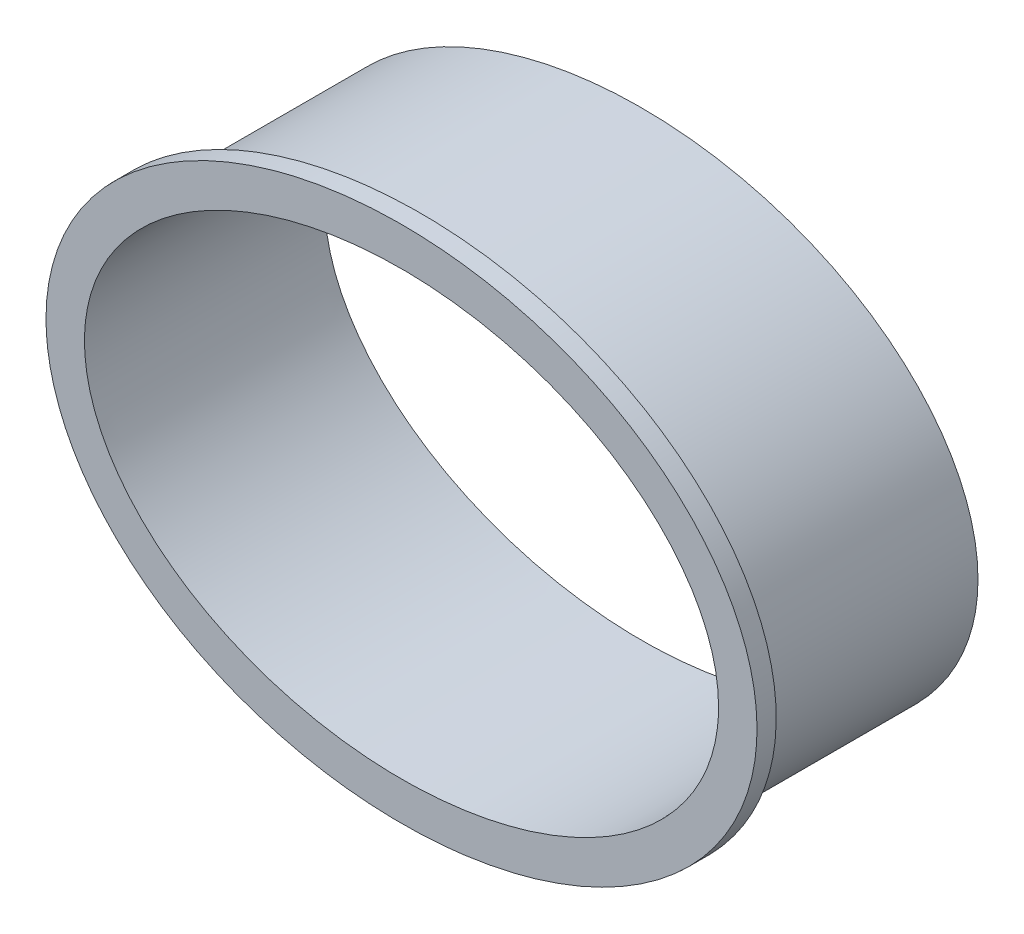
from build123d import *

# Parameters (mm, degrees)
EXTRUDE_1_DEPTH = 25
EXTRUDE_2_DEPTH = 2


# Read off the part's stored shape, not the designer's step: 填料-伸長1
with BuildPart() as part:
    # 填料-伸長1 outline → 填料-伸長1 (new body)
    with BuildSketch(Plane.XY):
        with BuildLine():
            add(Edge.make_bspline(
                [(35, 0), (35, 43.301270189), (-17.5, 21.650635095), (-70, 0), (-17.5, -21.650635095), (35, -43.301270189), (35, 0)],
                knots=[0, 0, 0, 2.094395102, 2.094395102, 4.188790205, 4.188790205, 6.283185307, 6.283185307, 6.283185307], degree=2, weights=[1, 0.5, 1, 0.5, 1, 0.5, 1]))
        make_face()
        with BuildLine():
            add(Edge.make_bspline(
                [(33, 0), (33, 2.91062285), (31.39993461, 8.73186855), (24.234101357, 16.455208235), (13.181225686, 21.748514032), (0, 23.625742984), (-13.181225686, 21.748514032), (-24.234101357, 16.455208235), (-31.39993461, 8.73186855), (-33.800032695, 0), (-31.39993461, -8.73186855), (-24.234101357, -16.455208235), (-13.181225686, -21.748514032), (0, -23.625742984), (13.181225686, -21.748514032), (24.234101357, -16.455208235), (31.39993461, -8.73186855), (33, -2.91062285), (33, 0)],
                knots=[0, 0, 0, 0, 0.392699082, 0.785398163, 1.178097245, 1.570796327, 1.963495408, 2.35619449, 2.748893572, 3.141592654, 3.534291735, 3.926990817, 4.319689899, 4.71238898, 5.105088062, 5.497787144, 5.890486225, 6.283185307, 6.283185307, 6.283185307, 6.283185307], degree=3))
        make_face(mode=Mode.SUBTRACT)
    extrude(amount=EXTRUDE_1_DEPTH)

    # 草圖2 → 填料-伸長2 (add)
    with BuildSketch(Plane.XY.offset(25)):
        with BuildLine():
            add(Edge.make_bspline(
                [(-37, 0), (-37, -2.136832017), (-36.660364323, -4.204280496), (-35.854316476, -6.710654505), (-35.67375068, -7.20797506), (-35.273935101, -8.194713489), (-35.055732014, -8.681236431), (-34.355276409, -10.107573172), (-33.825011398, -11.020183003), (-32.943433003, -12.33697453), (-32.635160203, -12.767187684), (-31.990735827, -13.610752576), (-31.653741168, -14.024967171), (-30.614345273, -15.229230134), (-29.880747277, -15.985362497), (-27.572530789, -18.130376645), (-25.889784944, -19.398189238), (-22.285928318, -21.64737414), (-20.413023851, -22.599258986), (-16.550004255, -24.217817778), (-14.559587544, -24.883757879), (-11.492367383, -25.684121157), (-10.45654693, -25.917207139), (-8.385534071, -26.312972134), (-7.346888776, -26.476613945), (-4.22189821, -26.868765359), (-2.126562083, -26.99919714), (1.034267364, -27.000395928), (2.093980935, -26.967984163), (4.2038584, -26.837232933), (5.251492414, -26.739276321), (8.3726586, -26.348458742), (10.424627929, -25.959421732), (14.467927585, -24.910881534), (16.459360378, -24.251835375), (18.904729516, -23.232124452), (19.391138731, -23.018416315), (20.351032648, -22.574194411), (20.825525229, -22.343270937), (22.232243483, -21.623422567), (23.147759775, -21.107500677), (24.931011666, -19.998458643), (25.79876899, -19.405373602), (27.060807507, -18.45176925), (27.474871072, -18.123211898), (28.288890792, -17.443304151), (28.689451842, -17.091301544), (30.633515315, -15.290092597), (32.019319225, -13.707088755), (33.791271404, -11.075450611), (34.332239988, -10.14914823), (35.268555763, -8.252953875), (35.667947997, -7.278437245), (36.157109697, -5.774428981), (36.301794863, -5.266035709), (36.552615777, -4.234438653), (36.658979766, -3.709069851), (36.913064395, -2.136299253), (36.998082413, -1.086565042), (37.001853661, 1.015308483), (36.920614652, 2.067447685), (36.670553165, 3.647511008), (36.566236551, 4.170758002), (36.319274546, 5.200902154), (36.176388964, 5.709360633), (35.6917894, 7.215669264), (35.294317863, 8.194515756), (34.591727483, 9.626527307), (34.339417598, 10.098090014), (33.807398354, 11.01685501), (33.526919467, 11.465741), (32.644588542, 12.782732843), (32.001984412, 13.621275711), (30.617203699, 15.226128118), (29.872190359, 15.994198283), (27.548576668, 18.150845672), (25.868885919, 19.411747392), (23.187751552, 21.084282892), (22.26475507, 21.605896701), (20.37556149, 22.574392282), (19.41769894, 23.017259963), (16.508056935, 24.233398048), (14.520516048, 24.895117206), (11.475189145, 25.688011085), (10.449327679, 25.918768594), (8.376519332, 26.31451152), (7.326434353, 26.479756877), (4.181332095, 26.872681011), (2.08407981, 27.000560373), (-2.111416204, 26.999435964), (-4.209659909, 26.87043863), (-6.833113477, 26.541052501), (-7.358756476, 26.466548615), (-8.403870267, 26.301202701), (-8.923628306, 26.210359037), (-10.474511105, 25.913331257), (-11.497260878, 25.68269803), (-14.531457815, 24.891389182), (-16.509189357, 24.232287493), (-19.400773884, 23.024650023), (-20.352058471, 22.585388374), (-21.758277531, 21.866043529), (-22.223558249, 21.61616414), (-23.146782643, 21.094986327), (-23.605552531, 20.823120252), (-25.8578096, 19.420710113), (-27.542882479, 18.155153757), (-29.476967072, 16.361263564), (-29.855067914, 15.991761248), (-30.592685053, 15.229890153), (-30.953167838, 14.83638597), (-31.997318386, 13.627441536), (-32.640688315, 12.787854352), (-33.81474145, 11.036823876), (-34.345492048, 10.125423557), (-35.047761852, 8.698474559), (-35.266805586, 8.211200014), (-35.668235181, 7.2226618), (-35.849534466, 6.724414423), (-36.335140549, 5.217728209), (-36.581364818, 4.197388167), (-36.830662237, 2.642281917), (-36.893704509, 2.119803482), (-36.978371825, 1.066360153), (-37, 0.534208004), (-37, 0)],
                knots=[0, 0, 0, 0, 0.03125, 0.03125, 0.0390625, 0.0390625, 0.046875, 0.046875, 0.0625, 0.0625, 0.0703125, 0.0703125, 0.078125, 0.078125, 0.09375, 0.09375, 0.125, 0.125, 0.15625, 0.15625, 0.1875, 0.1875, 0.203125, 0.203125, 0.21875, 0.21875, 0.25, 0.25, 0.265625, 0.265625, 0.28125, 0.28125, 0.3125, 0.3125, 0.34375, 0.34375, 0.3515625, 0.3515625, 0.359375, 0.359375, 0.375, 0.375, 0.390625, 0.390625, 0.3984375, 0.3984375, 0.40625, 0.40625, 0.4375, 0.4375, 0.453125, 0.453125, 0.46875, 0.46875, 0.4765625, 0.4765625, 0.484375, 0.484375, 0.5, 0.5, 0.515625, 0.515625, 0.5234375, 0.5234375, 0.53125, 0.53125, 0.546875, 0.546875, 0.5546875, 0.5546875, 0.5625, 0.5625, 0.578125, 0.578125, 0.59375, 0.59375, 0.625, 0.625, 0.640625, 0.640625, 0.65625, 0.65625, 0.6875, 0.6875, 0.703125, 0.703125, 0.71875, 0.71875, 0.75, 0.75, 0.78125, 0.78125, 0.7890625, 0.7890625, 0.796875, 0.796875, 0.8125, 0.8125, 0.84375, 0.84375, 0.859375, 0.859375, 0.8671875, 0.8671875, 0.875, 0.875, 0.90625, 0.90625, 0.9140625, 0.9140625, 0.921875, 0.921875, 0.9375, 0.9375, 0.953125, 0.953125, 0.9609375, 0.9609375, 0.96875, 0.96875, 0.984375, 0.984375, 0.9921875, 0.9921875, 1, 1, 1, 1], degree=3))
        make_face()
        with BuildLine():
            add(Edge.make_bspline(
                [(33, 0), (33, 2.91062285), (31.39993461, 8.73186855), (24.234101357, 16.455208235), (13.181225686, 21.748514032), (0, 23.625742984), (-13.181225686, 21.748514032), (-24.234101357, 16.455208235), (-31.39993461, 8.73186855), (-33.800032695, 0), (-31.39993461, -8.73186855), (-24.234101357, -16.455208235), (-13.181225686, -21.748514032), (0, -23.625742984), (13.181225686, -21.748514032), (24.234101357, -16.455208235), (31.39993461, -8.73186855), (33, -2.91062285), (33, 0)],
                knots=[0, 0, 0, 0, 0.392699082, 0.785398163, 1.178097245, 1.570796327, 1.963495408, 2.35619449, 2.748893572, 3.141592654, 3.534291735, 3.926990817, 4.319689899, 4.71238898, 5.105088062, 5.497787144, 5.890486225, 6.283185307, 6.283185307, 6.283185307, 6.283185307], degree=3))
        make_face(mode=Mode.SUBTRACT)
    extrude(amount=-EXTRUDE_2_DEPTH)


solid = part.part
